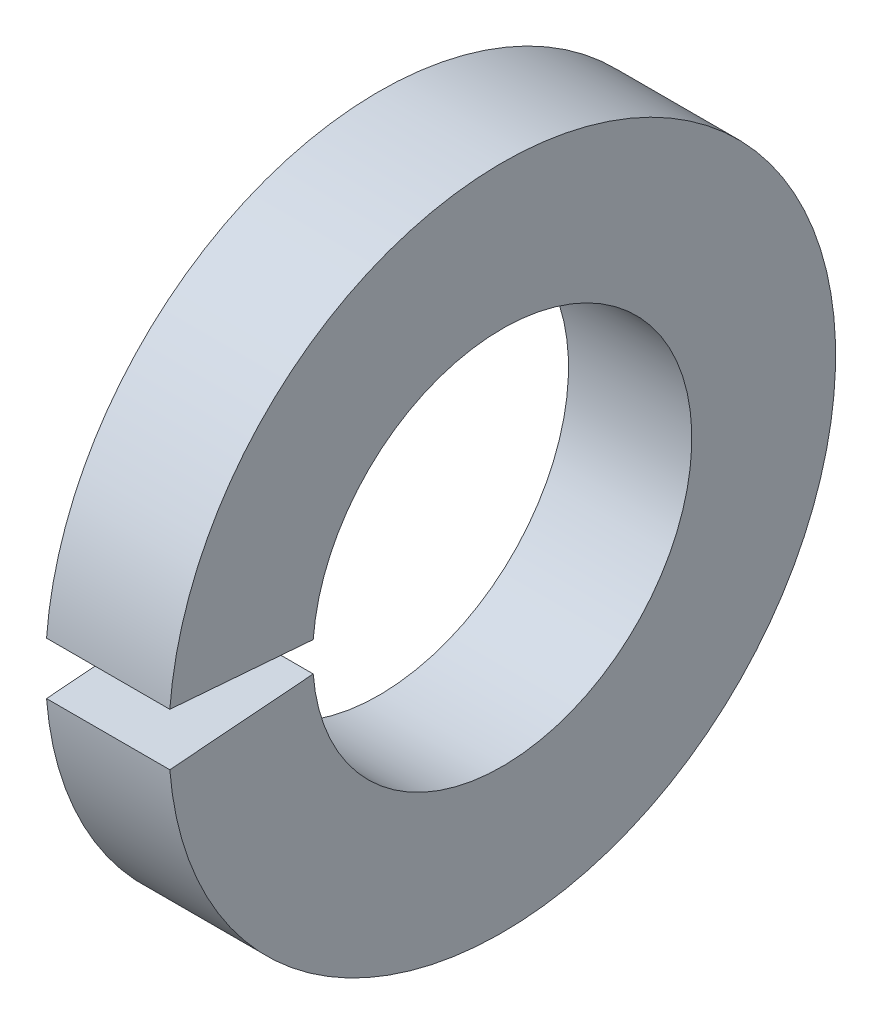
from build123d import *

# Parameters (mm, degrees)
SKETCH1_W = 8.382
SKETCH1_H = 9.779
GAP_DEPTH = 34.137145087


with BuildPart() as part:
    # Sketch1 → Base-Revolve (revolve)
    with BuildSketch(Plane.XY):
        with Locations((-4.191, 17.78)):
            Rectangle(SKETCH1_W, SKETCH1_H)
    revolve(axis=Axis((-34.925, 0, 0), (1, 0, 0)))

    # Sketch2 → Gap (cut, through all)
    with BuildSketch(Plane(origin=(0, 0, 0), x_dir=(0, -1, 0), z_dir=(-1, 0, 0))):
        with BuildLine():
            Line((0, 0), (1.81420104, 23.051609847))
            ThreePointArc((1.81420104, 23.051609847), (0, 23.12289), (-1.81420104, 23.051609847))
            Line((-1.81420104, 23.051609847), (0, 0))
        make_face()
    extrude(amount=GAP_DEPTH, mode=Mode.SUBTRACT)


solid = part.part
